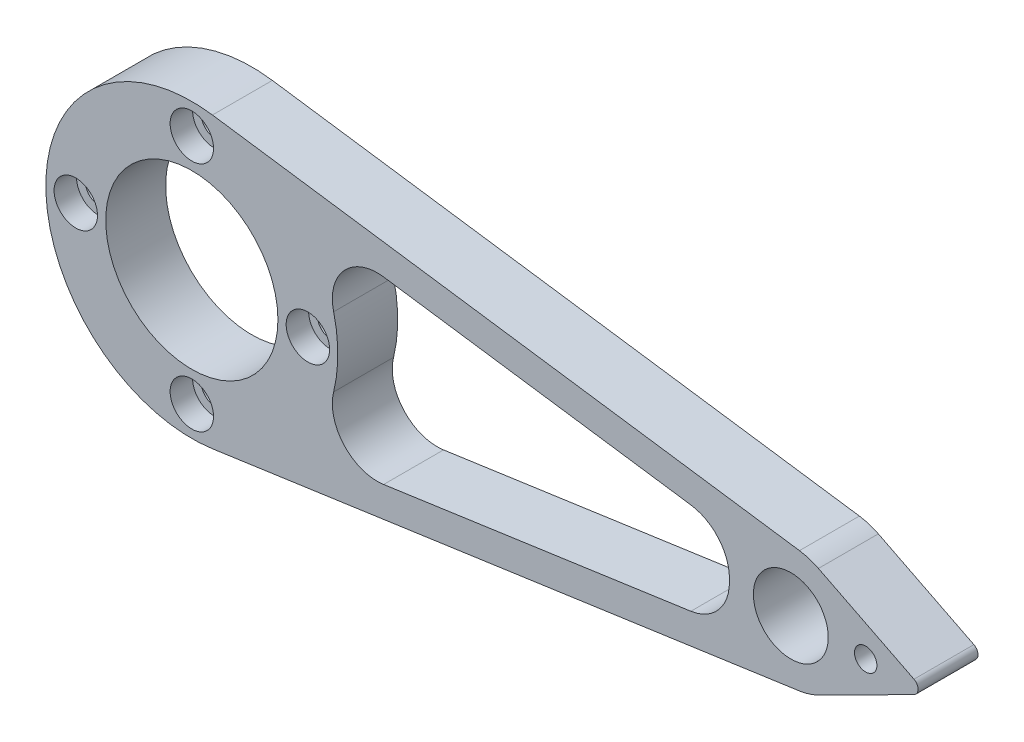
from build123d import *

# Parameters (mm, degrees)
ESQUISSE1_R             = 19.5
ESQUISSE1_R_2           = 1.7
ESQUISSE1_R_3           = 11.5
BOSS_EXTRU_1_DEPTH      = 8
BOSS_EXTRU_2_START      = -8
ESQUISSE2_R             = 5
BOSS_EXTRU_2_DEPTH      = 8
ENL_V_MAT_EXTRU_1_DEPTH = 91.683460454
CONG_1_R                = 6
ESQUISSE4_R             = 1.5
BOSS_EXTRU_3_DEPTH      = 8
ESQUISSE5_R             = 2.9
ENL_V_MAT_EXTRU_2_DEPTH = 3


with BuildPart() as part:
    # Esquisse1 → Boss.-Extru.1 (new body)
    with BuildSketch(Plane.XY):
        Circle(ESQUISSE1_R)
        with Locations((0, 15.5)):
            Circle(ESQUISSE1_R_2, mode=Mode.SUBTRACT)
        with Locations((15.5, 0)):
            Circle(ESQUISSE1_R_2, mode=Mode.SUBTRACT)
        with Locations((0, -15.5)):
            Circle(ESQUISSE1_R_2, mode=Mode.SUBTRACT)
        with Locations((-15.5, 0)):
            Circle(ESQUISSE1_R_2, mode=Mode.SUBTRACT)
        Circle(ESQUISSE1_R_3, mode=Mode.SUBTRACT)
    extrude(amount=BOSS_EXTRU_1_DEPTH)

    # Esquisse2 → Boss.-Extru.2 (add)
    with BuildSketch(Plane.XY.offset(8).offset(BOSS_EXTRU_2_START)):
        with BuildLine():
            Line((2.754375, 19.304492181), (81.15825, 8.117786456))
            ThreePointArc((81.15825, 8.117786456), (88.2, 0), (81.15825, -8.117786456))
            Line((81.15825, -8.117786456), (2.754375, -19.304492181))
            ThreePointArc((2.754375, -19.304492181), (19.5, 0), (2.754375, 19.304492181))
        make_face()
        with Locations((80, 0)):
            Circle(ESQUISSE2_R, mode=Mode.SUBTRACT)
    extrude(amount=BOSS_EXTRU_2_DEPTH)

    # Esquisse3 → Enlèv. mat.-Extru.1 (cut, through all)
    with BuildSketch(Plane.XY.offset(8)):
        with BuildLine():
            Line((13.902904837, 13.67330381), (73.62113393, 5.152675776))
            ThreePointArc((73.62113393, 5.152675776), (71.8, 0), (73.62113393, -5.152675776))
            Line((73.62113393, -5.152675776), (13.902904837, -13.67330381))
            ThreePointArc((13.902904837, -13.67330381), (19.5, 0), (13.902904837, 13.67330381))
        make_face()
    extrude(amount=-ENL_V_MAT_EXTRU_1_DEPTH, mode=Mode.SUBTRACT)

    # Congé1
    cong_1_edges = [part.edges().sort_by_distance(p)[0] for p in [
        (73.62113393, -5.152675776, 4),
        (73.62113393, 5.152675776, 4),
        (13.902904837, -13.67330381, 4),
        (13.902904837, 13.67330381, 4),
    ]]
    fillet(cong_1_edges, radius=CONG_1_R)

    # Esquisse4 → Boss.-Extru.3 (add)
    with BuildSketch(Plane.XY.offset(8)):
        with BuildLine():
            Line((83.69, 7.322834151), (96.45, 0.893028555))
            ThreePointArc((96.45, 0.893028555), (97, 0), (96.45, -0.893028555))
            Line((96.45, -0.893028555), (83.69, -7.322834151))
            ThreePointArc((83.69, -7.322834151), (88.2, 0), (83.69, 7.322834151))
        make_face()
        with Locations((90, 0)):
            Circle(ESQUISSE4_R, mode=Mode.SUBTRACT)
    extrude(amount=-BOSS_EXTRU_3_DEPTH)

    # Esquisse5 → Enlèv. mat.-Extru.2 (cut)
    with BuildSketch(Plane.XY.offset(8)):
        with Locations((0, 15.5)):
            Circle(ESQUISSE5_R)
        with Locations((15.5, 0)):
            Circle(ESQUISSE5_R)
        with Locations((0, -15.5)):
            Circle(ESQUISSE5_R)
        with Locations((-15.5, 0)):
            Circle(ESQUISSE5_R)
    extrude(amount=-ENL_V_MAT_EXTRU_2_DEPTH, mode=Mode.SUBTRACT)


solid = part.part
